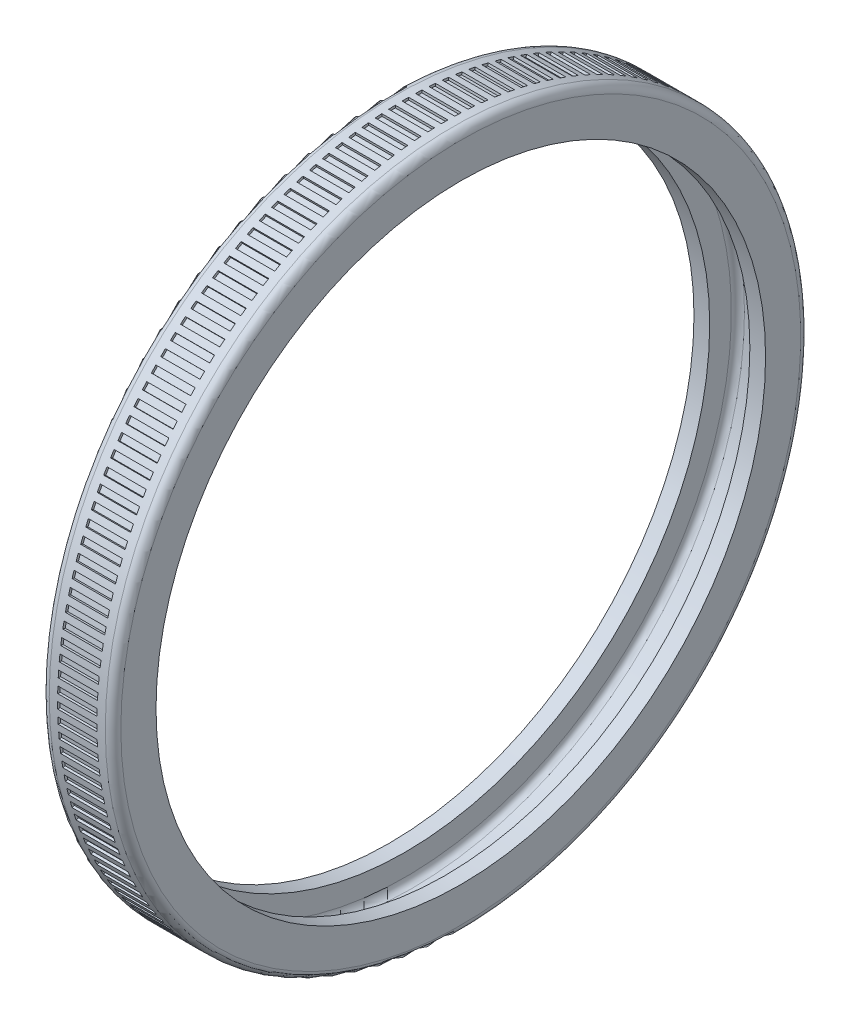
from build123d import *

# Parameters (mm, degrees)
SKETCH2_W          = 0.8
SKETCH2_H          = 2
CUT_EXTRUDE1_DEPTH = 2.4
CIRPATTERN1_COUNT  = 163


with BuildPart() as part:
    # Sketch1 → Revolve1 (revolve)
    with BuildSketch(Plane.XY):
        with BuildLine():
            Line((-4.375, 37.25), (-4.375, 41.55))
            ThreePointArc((-4.375, 41.55), (-4.096751442, 42.221751442), (-3.425, 42.5))
            Line((-3.425, 42.5), (3.425, 42.5))
            ThreePointArc((3.425, 42.5), (4.096751442, 42.221751442), (4.375, 41.55))
            Line((4.375, 41.55), (4.375, 37.25))
            Line((4.375, 37.25), (2.454347753, 37.25))
            Line((2.454347753, 37.25), (2.454347753, 39.9))
            ThreePointArc((2.454347753, 39.9), (2.220033178, 40.465685425), (1.654347753, 40.7))
            Line((1.654347753, 40.7), (-1.654347753, 40.7))
            ThreePointArc((-1.654347753, 40.7), (-2.220033178, 40.465685425), (-2.454347753, 39.9))
            Line((-2.454347753, 39.9), (-2.454347753, 37.25))
            Line((-2.454347753, 37.25), (-4.375, 37.25))
        make_face()
    revolve(axis=Axis((-1000, 0, 0), (1, 0, 0)))

    # Sketch2 → Cut-Extrude1 (cut, symmetric)
    with BuildSketch(Plane(origin=(0, 0, 0), x_dir=(0, 0, -1), z_dir=(1, 0, 0))):
        with Locations((0, 43.2)):
            Rectangle(SKETCH2_W, SKETCH2_H)
    cut_extrude1 = extrude(amount=CUT_EXTRUDE1_DEPTH, both=True, mode=Mode.SUBTRACT)

    # CirPattern1: Cut-Extrude1 ×163 about axis
    cirpattern1_axis = Axis((-1000, 0, 0), (-1, 0, 0))
    for i in range(1, CIRPATTERN1_COUNT):
        add(cut_extrude1.rotate(cirpattern1_axis, i * 360 / CIRPATTERN1_COUNT), mode=Mode.SUBTRACT)


solid = part.part
